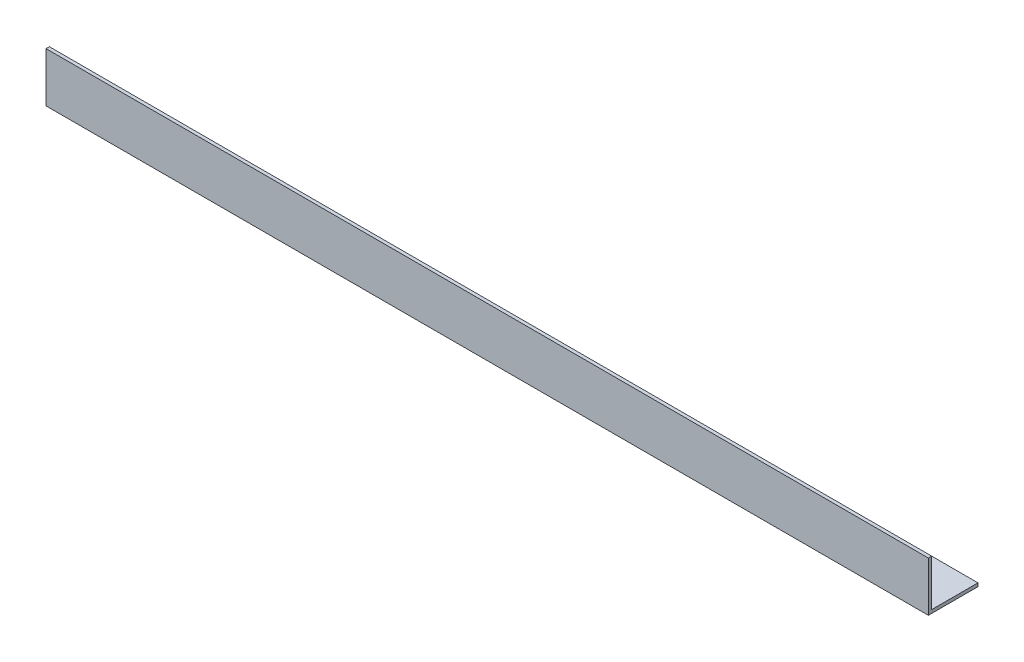
from build123d import *

# Parameters (mm, degrees)
EXTRUDE_1_DEPTH = 800


with BuildPart() as part:
    # Эскиз1 → Вытянуть-Тонкостенный1 (new body)
    with BuildSketch(Plane(origin=(0, 0, 0), x_dir=(0, 0, -1), z_dir=(1, 0, 0))):
        Polygon((45, 0), (0, 0), (0, 45), (3, 45), (3, 3), (45, 3), align=None)
    extrude(amount=EXTRUDE_1_DEPTH)


solid = part.part
